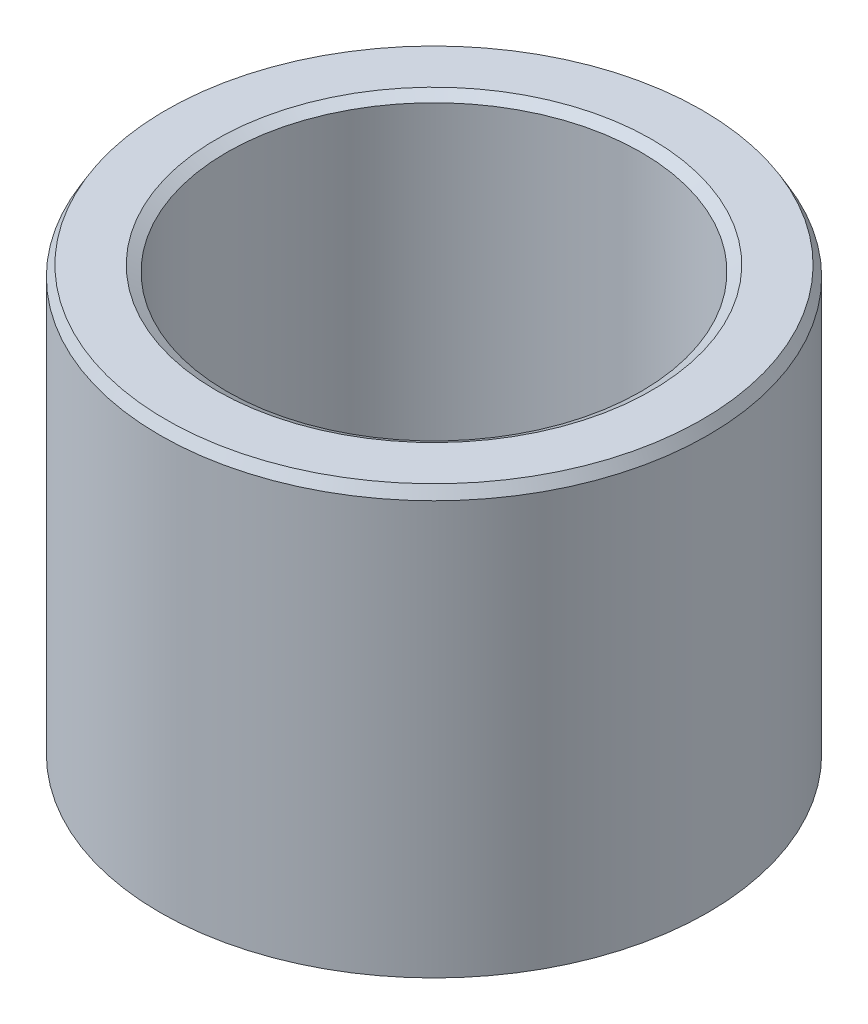
from build123d import *
from OCP.BRepFilletAPI import BRepFilletAPI_MakeChamfer

# Parameters (mm, degrees)
SKETCH1_R           = 40
BOSS_EXTRUDE1_DEPTH = 62.717191514
SKETCH2_R           = 30.227431144
CUT_EXTRUDE1_DEPTH  = 85.459730708
CHAMFER1_SIZE       = 1.529105371
CHAMFER1_SIZE2      = 0.882829398


with BuildPart() as part:
    # Sketch1 → Boss-Extrude1 (new body)
    with BuildSketch(Plane(origin=(0, 0, 0), x_dir=(1, 0, 0), z_dir=(0, 1, 0))):
        Circle(SKETCH1_R)
    extrude(amount=BOSS_EXTRUDE1_DEPTH)

    # Sketch2 → Cut-Extrude1 (cut, through all)
    with BuildSketch(Plane(origin=(0, 0, 0), x_dir=(1, 0, 0), z_dir=(0, 1, 0))):
        Circle(SKETCH2_R)
    extrude(amount=CUT_EXTRUDE1_DEPTH, mode=Mode.SUBTRACT)

    # Chamfer1: one chamfer whose edges measure the first distance from different faces: ONE call of the kernel's chamfer builder (chamfer() names one face for all edges)
    chamfer1_edges_1 = [part.edges().sort_by_distance(p)[0] for p in [
        (-30.227431144, 62.717191514, 0),
    ]]
    chamfer1_side_1 = [part.faces().sort_by_distance(p)[0] for p in [
        (-38.86862915, 62.717191514, 0),
    ]]
    chamfer1_edges_2 = [part.edges().sort_by_distance(p)[0] for p in [
        (-30.227431144, 0, 0),
    ]]
    chamfer1_side_2 = [part.faces().sort_by_distance(p)[0] for p in [
        (-30.227431144, 31.358595757, 0),
    ]]
    chamfer1_edges_3 = [part.edges().sort_by_distance(p)[0] for p in [
        (-40, 0, 0),
    ]]
    chamfer1_side_3 = [part.faces().sort_by_distance(p)[0] for p in [
        (-38.86862915, 0, 0),
    ]]
    chamfer1_edges_4 = [part.edges().sort_by_distance(p)[0] for p in [
        (-40, 62.717191514, 0),
    ]]
    chamfer1_side_4 = [part.faces().sort_by_distance(p)[0] for p in [
        (-40, 31.358595757, 0),
    ]]
    chamfer1 = BRepFilletAPI_MakeChamfer(part.part.solid().wrapped)
    for e in chamfer1_edges_1:
        chamfer1.Add(CHAMFER1_SIZE, CHAMFER1_SIZE2, e.wrapped, chamfer1_side_1[0].wrapped)  # the first distance lies on this face
    for e in chamfer1_edges_2:
        chamfer1.Add(CHAMFER1_SIZE, CHAMFER1_SIZE2, e.wrapped, chamfer1_side_2[0].wrapped)  # the first distance lies on this face
    for e in chamfer1_edges_3:
        chamfer1.Add(CHAMFER1_SIZE, CHAMFER1_SIZE2, e.wrapped, chamfer1_side_3[0].wrapped)  # the first distance lies on this face
    for e in chamfer1_edges_4:
        chamfer1.Add(CHAMFER1_SIZE, CHAMFER1_SIZE2, e.wrapped, chamfer1_side_4[0].wrapped)  # the first distance lies on this face
    add(Compound.cast(chamfer1.Shape()), mode=Mode.REPLACE)


solid = part.part
